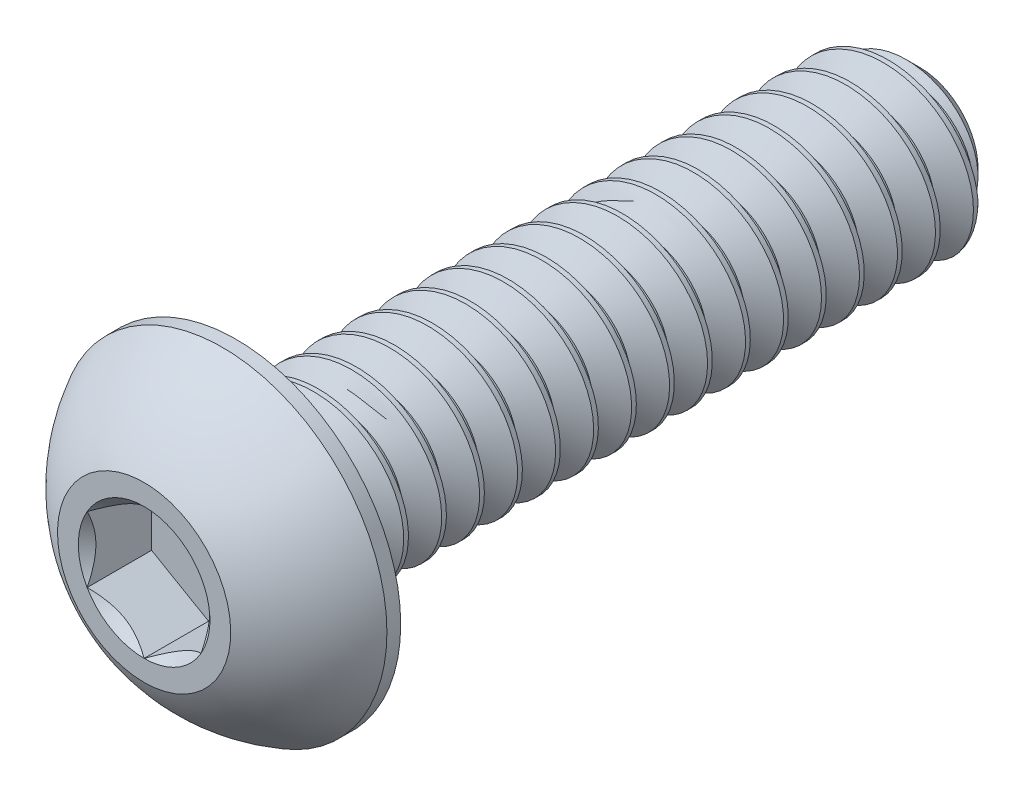
from build123d import *

# Parameters (mm, degrees)
SKETCH1_W          = 19.05
SKETCH1_H          = 2.413
CHAMFER1_SIZE      = 0.79375
CUT_SWEEP1_PITCH   = 1.058333333
CUT_EXTRUDE2_DEPTH = 1.79578
SKETCH6_R          = 1.833087105
CUT_EXTRUDE3_DEPTH = 1.79578
CUT_EXTRUDE3_TAPER = 45


with BuildPart() as part:
    # Sketch1 → Revolve1 (revolve)
    with BuildSketch(Plane(origin=(0, 0, 0), x_dir=(0, 0, -1), z_dir=(1, 0, 0))):
        with Locations((12.0904, 1.2065)):
            Rectangle(SKETCH1_W, SKETCH1_H)
    revolve(axis=Axis((0, 0, -21.6154), (0, 0, 1)))

    # Chamfer1
    chamfer1_edges = [part.edges().sort_by_distance(p)[0] for p in [
        (0, -2.413, -21.6154),
    ]]
    chamfer(chamfer1_edges, length=CHAMFER1_SIZE)

    # Cut-Sweep1: arcs per turn and ends read off the stored shape
    # Cut-Sweep1: the profile of Sketch2 profile screwed along a right-hand helix through 19 turns, 8 arcs to a turn; built about Z, then put on its axis
    cut_sweep1_z = Axis((0, 0, 0), (0, 0, 1))
    cut_sweep1_corners = [(2.4133, 0, 0.000173205), (2.4133, 0, -0.926214872), (1.725592336, 0, -0.529166667), (1.725592336, 0, -0.396875)]
    with BuildLine(mode=Mode.PRIVATE) as cut_sweep1_profile:
        Line(cut_sweep1_corners[0], cut_sweep1_corners[1])
        Line(cut_sweep1_corners[1], cut_sweep1_corners[2])
        Line(cut_sweep1_corners[2], cut_sweep1_corners[3])
        Line(cut_sweep1_corners[3], cut_sweep1_corners[0])
    cut_sweep1_cap = Face(cut_sweep1_profile.wire())
    cut_sweep1_turn_angles = [0, 22.5, 45, 67.5, 90, 112.5, 135, 157.5, 180, 202.5, 225, 247.5, 270, 292.5, 315, 337.5, 360]
    cut_sweep1_turn_weights = [1, 0.9238795325112867, 1, 0.9238795325112867, 1, 0.9238795325112867, 1, 0.9238795325112867, 1, 0.9238795325112867, 1, 0.9238795325112867, 1, 0.9238795325112867, 1, 0.9238795325112867, 1]
    cut_sweep1_turn_rails = [Edge.make_bspline([Vector(p[0], p[1], 0).rotate(cut_sweep1_z, cut_sweep1_turn_angles[k]) / cut_sweep1_turn_weights[k] + Vector(0, 0, p[2] + CUT_SWEEP1_PITCH * cut_sweep1_turn_angles[k] / 360) for k in range(17)], [0, 0, 0, 1, 1, 2, 2, 3, 3, 4, 4, 5, 5, 6, 6, 7, 7, 8, 8, 8], 2, cut_sweep1_turn_weights) for p in cut_sweep1_corners]
    cut_sweep1_turn_sides = [Face.make_surface_from_curves(cut_sweep1_turn_rails[p[0]], cut_sweep1_turn_rails[p[1]]) for p in [(0, 1), (1, 2), (2, 3), (3, 0)]]
    cut_sweep1 = Plane(origin=(0, 0, -21.6154), x_dir=(0, 1, 0), z_dir=(0, 0, 1)) * Solid(Shell([*[p.moved(Location((0, 0, CUT_SWEEP1_PITCH * i))) for i in range(19) for p in cut_sweep1_turn_sides], cut_sweep1_cap, cut_sweep1_cap.rotate(cut_sweep1_z, 6840).moved(Location((0, 0, CUT_SWEEP1_PITCH * 6840 / 360)))]))
    add(cut_sweep1, mode=Mode.SUBTRACT)

    # Sketch7 → Revolve2 (revolve)
    with BuildSketch(Plane(origin=(0, 0, 0), x_dir=(0, 0, -1), z_dir=(1, 0, 0)), mode=Mode.PRIVATE) as revolve2_sk:
        with BuildLine():
            Line((2.18059, 4.5847), (2.5654, 4.5847))
            Line((2.5654, 4.5847), (2.5654, 0))
            Line((2.5654, 0), (0, 0))
            Line((0, 0), (0, 2.413))
            ThreePointArc((0, 2.413), (0.925030326, 3.664791196), (2.18059, 4.5847))
        make_face()
    revolve(revolve2_sk.sketch.rotate(Axis((0, 0, 0), (0, 0, -1)), 189.052465709), axis=Axis((0, 0, 0), (0, 0, -1)))

    # Sketch5 → Cut-Extrude2 (cut)
    with BuildSketch(Plane.XY):
        Polygon((1.5875, -0.916543552), (1.5875, 0.916543552), (0, 1.833087105), (-1.5875, 0.916543552), (-1.5875, -0.916543552), (0, -1.833087105), align=None)
    extrude(amount=-CUT_EXTRUDE2_DEPTH, mode=Mode.SUBTRACT)

    # Sketch6 → Cut-Extrude3 (cut)
    with BuildSketch(Plane.XY):
        Circle(SKETCH6_R)
    extrude(amount=-CUT_EXTRUDE3_DEPTH, taper=CUT_EXTRUDE3_TAPER, mode=Mode.SUBTRACT)


solid = part.part
